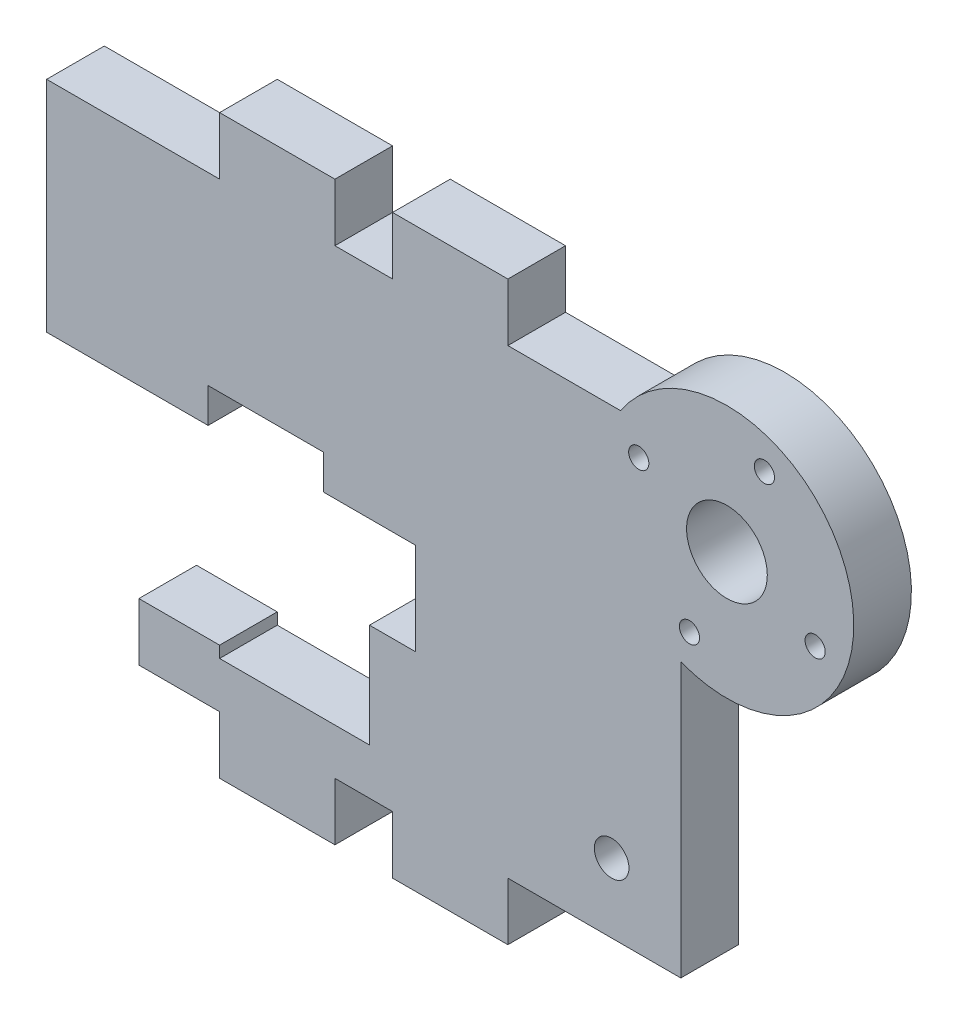
from build123d import *

# Parameters (mm, degrees)
ESQUISSE1_R        = 1.5
ESQUISSE1_R_2      = 0.875
ESQUISSE1_R_3      = 3.5
BOSS_EXTRU_1_DEPTH = 5


with BuildPart() as part:
    # Esquisse1 → Boss.-Extru.1 (new body)
    with BuildSketch(Plane.XY):
        with BuildLine():
            Line((10, -5), (10, 0))
            Line((10, 0), (15, 0))
            Line((15, 0), (15, -5))
            Line((15, -5), (25, -5))
            Line((25, -5), (25, 0))
            Line((25, 0), (40, 0))
            Line((40, 0), (40, 23.753049234))
            ThreePointArc((40, 23.753049234), (54.472819163, 37.364529505), (34.780455543, 40))
            Line((34.780455543, 40), (25, 40))
            Line((25, 40), (25, 45))
            Line((25, 45), (15, 45))
            Line((15, 45), (15, 40))
            Line((15, 40), (10, 40))
            Line((10, 40), (10, 45))
            Line((10, 45), (0, 45))
            Line((0, 45), (0, 40))
            Line((0, 40), (-15, 40))
            Line((-15, 40), (-15, 21))
            Line((-15, 21), (-1, 21))
            Line((-1, 21), (-1, 24))
            Line((-1, 24), (9, 24))
            Line((9, 24), (9, 21))
            Line((9, 21), (17, 21))
            Line((17, 21), (17, 13))
            Line((17, 13), (13, 13))
            Line((13, 13), (13, 4))
            Line((13, 4), (0, 4))
            Line((0, 4), (0, 5))
            Line((0, 5), (-7, 5))
            Line((-7, 5), (-7, 0))
            Line((-7, 0), (0, 0))
            Line((0, 0), (0, -5))
            Line((0, -5), (10, -5))
        make_face()
        with Locations((34, 6)):
            Circle(ESQUISSE1_R, mode=Mode.SUBTRACT)
        with Locations((40.75, 26.35)):
            Circle(ESQUISSE1_R_2, mode=Mode.SUBTRACT)
        with Locations((51.65, 30.75)):
            Circle(ESQUISSE1_R_2, mode=Mode.SUBTRACT)
        with Locations((36.35, 37.25)):
            Circle(ESQUISSE1_R_2, mode=Mode.SUBTRACT)
        with Locations((44, 34)):
            Circle(ESQUISSE1_R_3, mode=Mode.SUBTRACT)
        with Locations((47.25, 41.65)):
            Circle(ESQUISSE1_R_2, mode=Mode.SUBTRACT)
    extrude(amount=BOSS_EXTRU_1_DEPTH)


solid = part.part
